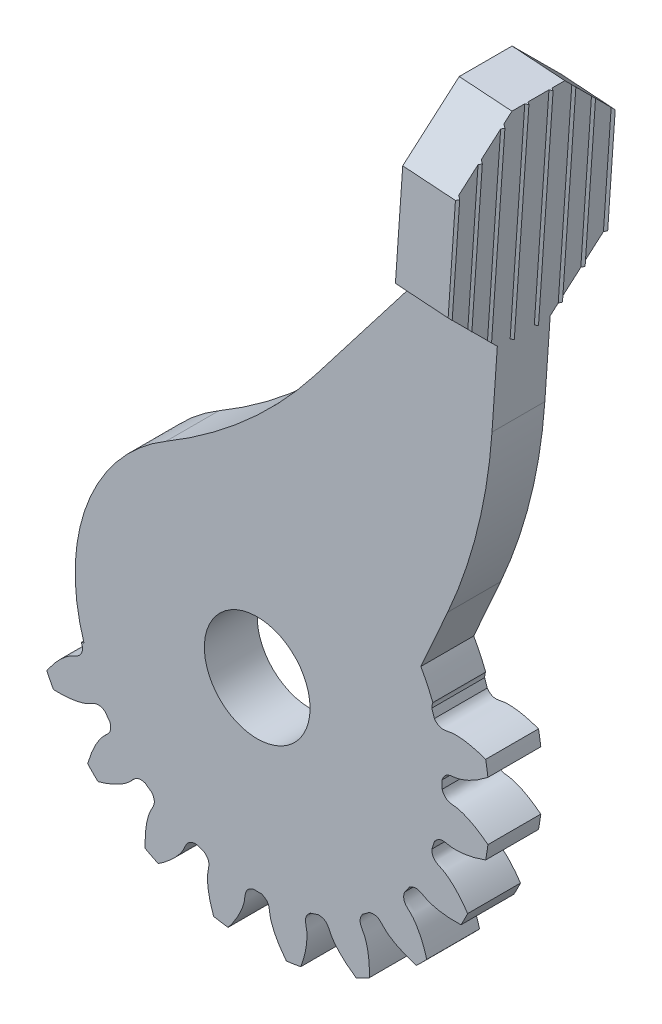
from build123d import *

# Parameters (mm, degrees)
SKETCH_1_R               = 22
EXTRUDE_1_DEPTH          = 30
CUT_EXTRUDE_1_DEPTH      = 44.22036557
PATTERN_CIRCULAR_1_COUNT = 20
SKETCH_4_R               = 42.426020528
CUT_EXTRUDE_2_DEPTH      = 25
SKETCH_5_R               = 5
CUT_EXTRUDE_3_DEPTH      = 30
CUT_EXTRUDE_6_DEPTH      = 32.270043673
CUT_EXTRUDE_6_DEPTH_BACK = 32.270043673
EXTRUDE_2_DEPTH          = 5
EXTRUDE_3_DEPTH          = 5
EXTRUDE_4_DEPTH          = 7.5
CHAMFER_START            = 15
CHAMFER_1_DEPTH          = 5
CHAMFER_START_2          = 11.666666667
CHAMFER_1_2_DEPTH        = 8.333333333
CHAMFER_START_3          = 12.209074983
CHAMFER_1_3_OUTLINE_W    = 4.519245585
CHAMFER_1_3_OUTLINE_H    = 7
CHAMFER_1_3_OUTLINE_H_2  = 6
CHAMFER_1_3_DEPTH        = 33.553691206
FILLET_1_R               = 50
EXTRUDE_5_DEPTH          = 30
SKETCH_11_OUTSIDE_W      = 35.642
SKETCH_11_OUTSIDE_H      = 104.155
SKETCH_11_OUTSIDE_W_2    = 36.333148422
SKETCH_11_OUTSIDE_H_2    = 42.370704243
CUT_EXTRUDE_7_DEPTH      = 30


with BuildPart() as part:
    # 草图1 → 凸台-拉伸1 (new body)
    with BuildSketch(Plane.XY):
        Circle(SKETCH_1_R)
    extrude(amount=EXTRUDE_1_DEPTH)

    # 草图2 → 切除-拉伸1 (cut, through all)
    with BuildSketch(Plane.XY):
        with BuildLine():
            ThreePointArc((0.386633201, 17.495728472), (0, 17.5), (-0.386633201, 17.495728472))
            add(Edge.make_bspline(
                [(-0.386633201, 17.495728472), (-1.22237881, 17.786951024), (-1.114168199, 18.374227398), (-1.225794113, 18.940018805), (-1.237784373, 18.995113228), (-1.25262178, 19.05726923), (-1.270584194, 19.126393672), (-1.29195828, 19.202382994), (-1.31702411, 19.285125656), (-1.346059743, 19.374501466), (-1.3793395, 19.470381894), (-1.4171342, 19.57263009), (-1.459710797, 19.681101001), (-1.507332204, 19.795641461), (-1.560257063, 19.916090303), (-1.618739529, 20.042278463), (-1.683029067, 20.174029102), (-1.753370234, 20.311157723), (-1.830002477, 20.4534723), (-1.913159931, 20.600773408), (-2.003071219, 20.752854362), (-2.099959252, 20.909501356), (-2.204041043, 21.070493611), (-2.315527511, 21.235603527), (-2.434623302, 21.404596841), (-2.561526601, 21.577232781), (-2.696428961, 21.753264241), (-2.839515123, 21.932437945), (-2.990962853, 22.114494623), (-3.15094277, 22.299169189), (-3.319618193, 22.486190926), (-3.497144978, 22.67528367), (-3.683671369, 22.866166005), (-3.879337852, 23.058551454), (-4.084277013, 23.252148679), (-4.298613397, 23.446661685), (-4.522463379, 23.641790022), (-4.755935037, 23.837228999), (-4.999128023, 24.032669892), (-5.252133469, 24.227800163), (-5.515033799, 24.42230368), (-5.882947182, 24.683279735), (-6.167864825, 24.872665202), (-6.362315964, 24.996503719)],
                knots=[0, 0, 0, 0, 0.165916003, 0.170905922, 0.176663519, 0.183188797, 0.190481754, 0.198542391, 0.207370708, 0.216966704, 0.22733038, 0.238461736, 0.250360771, 0.263027487, 0.276461881, 0.290663956, 0.30563371, 0.321371144, 0.337876258, 0.355149051, 0.373189524, 0.391997677, 0.411573509, 0.431917021, 0.453028213, 0.474907084, 0.497553636, 0.520967867, 0.545149777, 0.570099367, 0.595816637, 0.622301587, 0.649554216, 0.677574526, 0.706362514, 0.735918183, 0.766241531, 0.797332559, 0.829191267, 0.861817654, 0.895211721, 0.929373468, 1, 1, 1, 1], degree=3))
            ThreePointArc((-6.362315964, 24.996503719), (0, 25.793492641), (6.362315964, 24.996503719))
            add(Edge.make_bspline(
                [(0.386633201, 17.495728472), (1.22237881, 17.786951024), (1.114168199, 18.374227398), (1.225794113, 18.940018805), (1.237784373, 18.995113228), (1.25262178, 19.05726923), (1.270584194, 19.126393672), (1.29195828, 19.202382994), (1.31702411, 19.285125656), (1.346059743, 19.374501466), (1.3793395, 19.470381894), (1.4171342, 19.57263009), (1.459710797, 19.681101001), (1.507332204, 19.795641461), (1.560257063, 19.916090303), (1.618739529, 20.042278463), (1.683029067, 20.174029102), (1.753370234, 20.311157723), (1.830002477, 20.4534723), (1.913159931, 20.600773408), (2.003071219, 20.752854362), (2.099959252, 20.909501356), (2.204041043, 21.070493611), (2.315527511, 21.235603527), (2.434623302, 21.404596841), (2.561526601, 21.577232781), (2.696428961, 21.753264241), (2.839515123, 21.932437945), (2.990962853, 22.114494623), (3.15094277, 22.299169189), (3.319618193, 22.486190926), (3.497144978, 22.67528367), (3.683671369, 22.866166005), (3.879337852, 23.058551454), (4.084277013, 23.252148679), (4.298613397, 23.446661685), (4.522463379, 23.641790022), (4.755935037, 23.837228999), (4.999128023, 24.032669892), (5.252133469, 24.227800163), (5.515033799, 24.42230368), (5.882947182, 24.683279735), (6.167864825, 24.872665202), (6.362315964, 24.996503719)],
                knots=[0, 0, 0, 0, 0.165916003, 0.170905922, 0.176663519, 0.183188797, 0.190481754, 0.198542391, 0.207370708, 0.216966704, 0.22733038, 0.238461736, 0.250360771, 0.263027487, 0.276461881, 0.290663956, 0.30563371, 0.321371144, 0.337876258, 0.355149051, 0.373189524, 0.391997677, 0.411573509, 0.431917021, 0.453028213, 0.474907084, 0.497553636, 0.520967867, 0.545149777, 0.570099367, 0.595816637, 0.622301587, 0.649554216, 0.677574526, 0.706362514, 0.735918183, 0.766241531, 0.797332559, 0.829191267, 0.861817654, 0.895211721, 0.929373468, 1, 1, 1, 1], degree=3))
        make_face()
    cut_extrude_1 = extrude(amount=CUT_EXTRUDE_1_DEPTH, mode=Mode.SUBTRACT)

    # 阵列(圆周)1: 切除-拉伸1 ×20 about axis
    pattern_circular_1_axis = Axis((0, 0, 30), (0, 0, -1))
    for i in range(1, PATTERN_CIRCULAR_1_COUNT):
        add(cut_extrude_1.rotate(pattern_circular_1_axis, i * 360 / PATTERN_CIRCULAR_1_COUNT), mode=Mode.SUBTRACT)

    # 草图4 → 切除-拉伸2 (cut)
    with BuildSketch(Plane.XY.offset(30)):
        Circle(SKETCH_4_R)
    extrude(amount=-CUT_EXTRUDE_2_DEPTH, mode=Mode.SUBTRACT)

    # 草图5 → 切除-拉伸3 (cut)
    with BuildSketch(Plane.XY.offset(5)):
        Circle(SKETCH_5_R)
    extrude(amount=-CUT_EXTRUDE_3_DEPTH, mode=Mode.SUBTRACT)

    # 草图6 → 切除-拉伸6 (cut, two sides: drawn at the far end of the back side and taken through both)
    with BuildSketch(Plane.XY.offset(5).offset(-CUT_EXTRUDE_6_DEPTH_BACK)):
        with BuildLine():
            Line((16.889540694, 5.502330594), (23.91824764, 7.792166059))
            ThreePointArc((23.91824764, 7.792166059), (-7.43354494, 23.667908241), (-23.417287493, -7.6289616))
            Line((-23.417287493, -7.6289616), (-16.388580547, -5.339126135))
            ThreePointArc((-16.388580547, -5.339126135), (-5.143728835, 16.639260718), (16.889540694, 5.502330594))
        make_face()
    extrude(amount=CUT_EXTRUDE_6_DEPTH + CUT_EXTRUDE_6_DEPTH_BACK, mode=Mode.SUBTRACT)

    # 草图7 → 凸台-拉伸2 (add)
    with BuildSketch(Plane.XY.offset(5)):
        Polygon((21.602943895, 22.439024521), (22.294265845, 32.415099599), (19.301443322, 32.622496184), (18.610121371, 22.646421106), (5.645909624, 11.362552582), (10, -0.692979899), align=None)
    extrude(amount=-EXTRUDE_2_DEPTH)

    # 草图8 → 凸台-拉伸3 (add)
    with BuildSketch(Plane.XY.offset(5)):
        Polygon((21.602943895, 22.439024521), (24.100081858, 58.473806567), (19.11204432, 58.819467542), (18.075061394, 43.855354925), (-4.416204167, 14.706945367), (15.358096411, 8.389211801), align=None)
    extrude(amount=-EXTRUDE_3_DEPTH)

    # 草图9 → 凸台-拉伸4 (add, symmetric)
    with BuildSketch(Plane.XY.offset(2.5)):
        Polygon((19.11204432, 58.819467542), (24.100081858, 58.473806567), (23.063098933, 43.50969395), (18.075061394, 43.855354925), align=None)
    extrude(amount=EXTRUDE_4_DEPTH, both=True)

    # 倒角1: read off the stored shape, not the designer's step
    # 倒角1 outline → 倒角1 (cut)
    with BuildSketch(Plane(origin=(0, 0, 0), x_dir=(0.06913219504311802, 0.9976075077947841, 0), z_dir=(0.9976075077947841, -0.06913219504311802, 0)).offset(CHAMFER_START)):
        Polygon((55, 10), (60, 5), (60, 10), align=None)
        Polygon((60, 0), (55, -5), (60, -5), align=None)
    extrude(amount=CHAMFER_1_DEPTH, mode=Mode.SUBTRACT)

    # Chamfer 1 2 outline → Chamfer 1 2 (add)
    with BuildSketch(Plane(origin=(0, 0, 0), x_dir=(0.06913219504311802, 0.9976075077947841, 0), z_dir=(0.9976075077947841, -0.06913219504311802, 0)).offset(CHAMFER_START_2)):
        Polygon((45, 0), (40, 0), (45, -5), align=None)
        Polygon((45, 10), (40, 5), (45, 5), align=None)
    extrude(amount=CHAMFER_1_2_DEPTH)

    # Chamfer 1 3 outline → Chamfer 1 3 (cut)
    with BuildSketch(Plane(origin=(0, 0, 0), x_dir=(0.7917119783383948, -0.6108945435633758, 0), z_dir=(0.6108945435633758, 0.7917119783383947, 0)).offset(CHAMFER_START_3)):
        with Locations((-14.740377207, 3.5)):
            Rectangle(CHAMFER_1_3_OUTLINE_W, CHAMFER_1_3_OUTLINE_H)
        with Locations((-14.740377207, -8)):
            Rectangle(CHAMFER_1_3_OUTLINE_W, CHAMFER_1_3_OUTLINE_H_2)
    extrude(amount=CHAMFER_1_3_DEPTH, mode=Mode.SUBTRACT)

    # 圆角1
    fillet_1_edges = [part.edges().sort_by_distance(p)[0] for p in [
        (-2.42270548, 17.29049568, 2.5),
        (21.602943895, 22.439024521, 2.5),
    ]]
    fillet(fillet_1_edges, radius=FILLET_1_R)

    # 草图10 → 凸台-拉伸5 (add)
    with BuildSketch(Plane(origin=(4.147931703, 59.856450468, 0), x_dir=(0.9976075077947841, -0.06913219504311871, 0), z_dir=(0.0691321950431187, 0.997607507794784, 0))):
        Polygon((20, 5), (20.25, 4.855662433), (20, 4.711324865), align=None)
        Polygon((20, 3), (20.25, 2.855662433), (20, 2.711324865), align=None)
        Polygon((20, 1), (20.25, 0.855662433), (20, 0.711324865), align=None)
        Polygon((20.25, -1.355662433), (20, -1.211324865), (20, -1.5), align=None)
        Polygon((20.25, -3.644337567), (20, -3.5), (20, -3.788675135), align=None)
        Polygon((20, -5.711324865), (20.25, -5.855662433), (20, -6), align=None)
        Polygon((20, -7.711324865), (20.25, -7.855662433), (20, -8), align=None)
        Polygon((20, -9.711324865), (20.25, -9.855662433), (20, -10), align=None)
    extrude(amount=-EXTRUDE_5_DEPTH)

    # 草图11 outside → 切除-拉伸7 (cut)
    with BuildSketch(Plane(origin=(19.952150156, -1.382643901, 0), x_dir=(0, 0, -1), z_dir=(0.9976075077947841, -0.06913219504311802, 0))):
        with Locations((-2.5, 18.6055)):
            Rectangle(SKETCH_11_OUTSIDE_W, SKETCH_11_OUTSIDE_H)
        Polygon((-5, 60), (0, 60), (5, 55), (5, 45), (0, 40), (-5, 40), (-10, 45), (-10, 55), align=None, mode=Mode.SUBTRACT)
        with Locations((-2.553906748, 0.169547732)):
            Rectangle(SKETCH_11_OUTSIDE_W_2, SKETCH_11_OUTSIDE_H_2, mode=Mode.SUBTRACT)
    extrude(amount=CUT_EXTRUDE_7_DEPTH, mode=Mode.SUBTRACT)


solid = part.part
